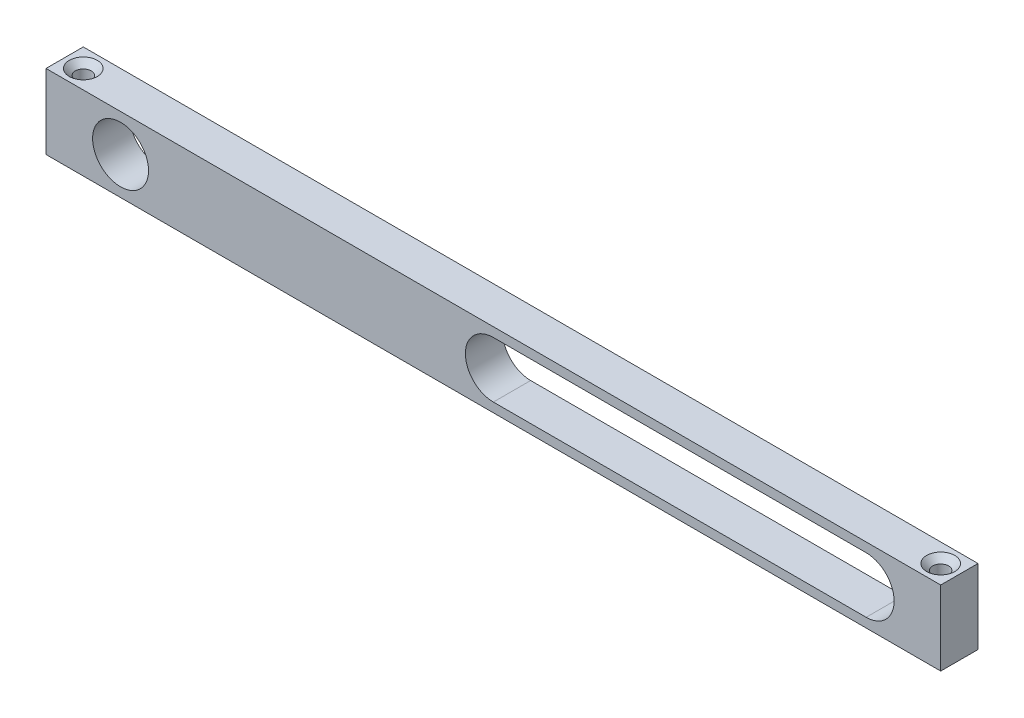
from build123d import *

# Parameters (mm, degrees)
SKETCH2_W                       = 152.4
SKETCH2_H                       = 12.7
SKETCH2_R                       = 4.7625
BOSS_EXTRUDE1_DEPTH             = 6.35
F_6_32_TAPPED_HOLE1_D           = 2.7051
F_6_32_TAPPED_HOLE1_CSINK_D     = 4.7752
F_6_32_TAPPED_HOLE1_CSINK_ANGLE = 90
F_6_32_TAPPED_HOLE2_D           = 2.7051
F_6_32_TAPPED_HOLE2_CSINK_D     = 4.7752
F_6_32_TAPPED_HOLE2_CSINK_ANGLE = 90


with BuildPart() as part:
    # Sketch2 → Boss-Extrude1 (new body)
    with BuildSketch(Plane.XY):
        Rectangle(SKETCH2_W, SKETCH2_H)
        with Locations((-63.5, 0)):
            Circle(SKETCH2_R, mode=Mode.SUBTRACT)
        with BuildLine():
            Line((0, -4.7625), (63.5, -4.7625))
            ThreePointArc((63.5, -4.7625), (68.2625, 0), (63.5, 4.7625))
            Line((63.5, 4.7625), (0, 4.7625))
            ThreePointArc((0, 4.7625), (-4.7625, 0), (0, -4.7625))
        make_face(mode=Mode.SUBTRACT)
    extrude(amount=BOSS_EXTRUDE1_DEPTH)

    # #6-32 Tapped Hole1 (through all)
    with Locations(Plane(origin=(0, 6.35, 0), x_dir=(1, 0, 0), z_dir=(0, 1, 0))):
        with Locations((-73.025, -3.175)):
            CounterSinkHole(F_6_32_TAPPED_HOLE1_D / 2, F_6_32_TAPPED_HOLE1_CSINK_D / 2, counter_sink_angle=F_6_32_TAPPED_HOLE1_CSINK_ANGLE)

    # #6-32 Tapped Hole2 (through all)
    with Locations(Plane(origin=(0, 6.35, 0), x_dir=(1, 0, 0), z_dir=(0, 1, 0))):
        with Locations((73.025, -3.175)):
            CounterSinkHole(F_6_32_TAPPED_HOLE2_D / 2, F_6_32_TAPPED_HOLE2_CSINK_D / 2, counter_sink_angle=F_6_32_TAPPED_HOLE2_CSINK_ANGLE)


solid = part.part
